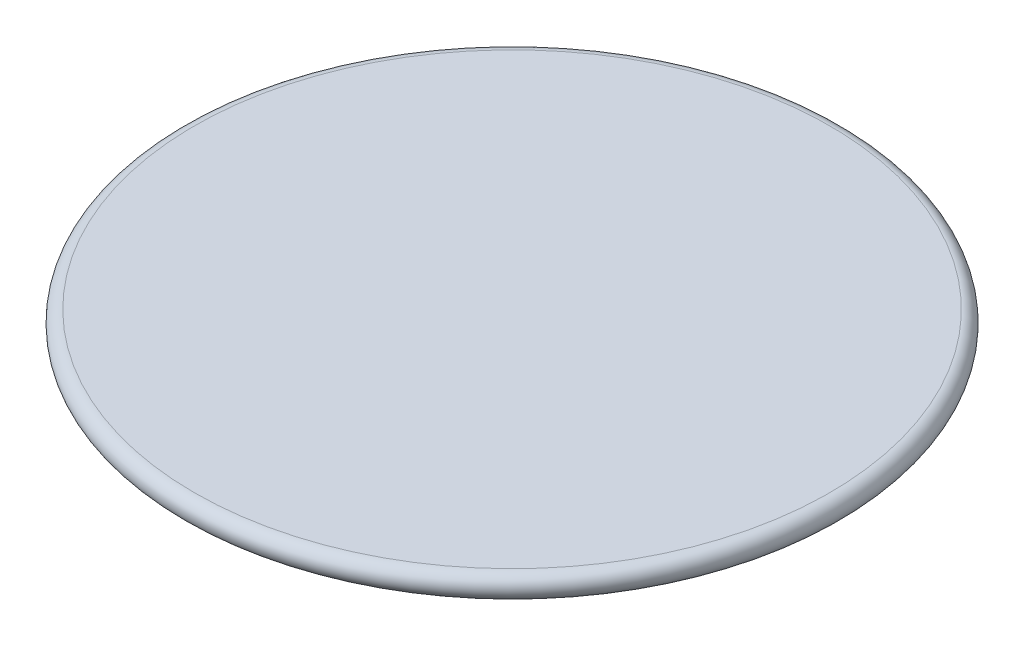
from build123d import *

# Parameters (mm, degrees)
SKETCH2_R           = 22.25
BOSS_EXTRUDE1_DEPTH = 1.6
FILLET2_R           = 0.8


with BuildPart() as part:
    # Sketch2 → Boss-Extrude1 (new body)
    with BuildSketch(Plane(origin=(0, 0, 0), x_dir=(1, 0, 0), z_dir=(0, 1, 0))):
        with Locations(Location((0, 0, 0), (0, 0, 270))):
            Circle(SKETCH2_R)
    extrude(amount=BOSS_EXTRUDE1_DEPTH)

    # Fillet2
    fillet2_edges = [part.edges().sort_by_distance(p)[0] for p in [
        (0, 0, -22.25),
        (0, 1.6, -22.25),
    ]]
    fillet(fillet2_edges, radius=FILLET2_R - 0.0001)  # a hair under: the kernel refuses the full size


solid = part.part
